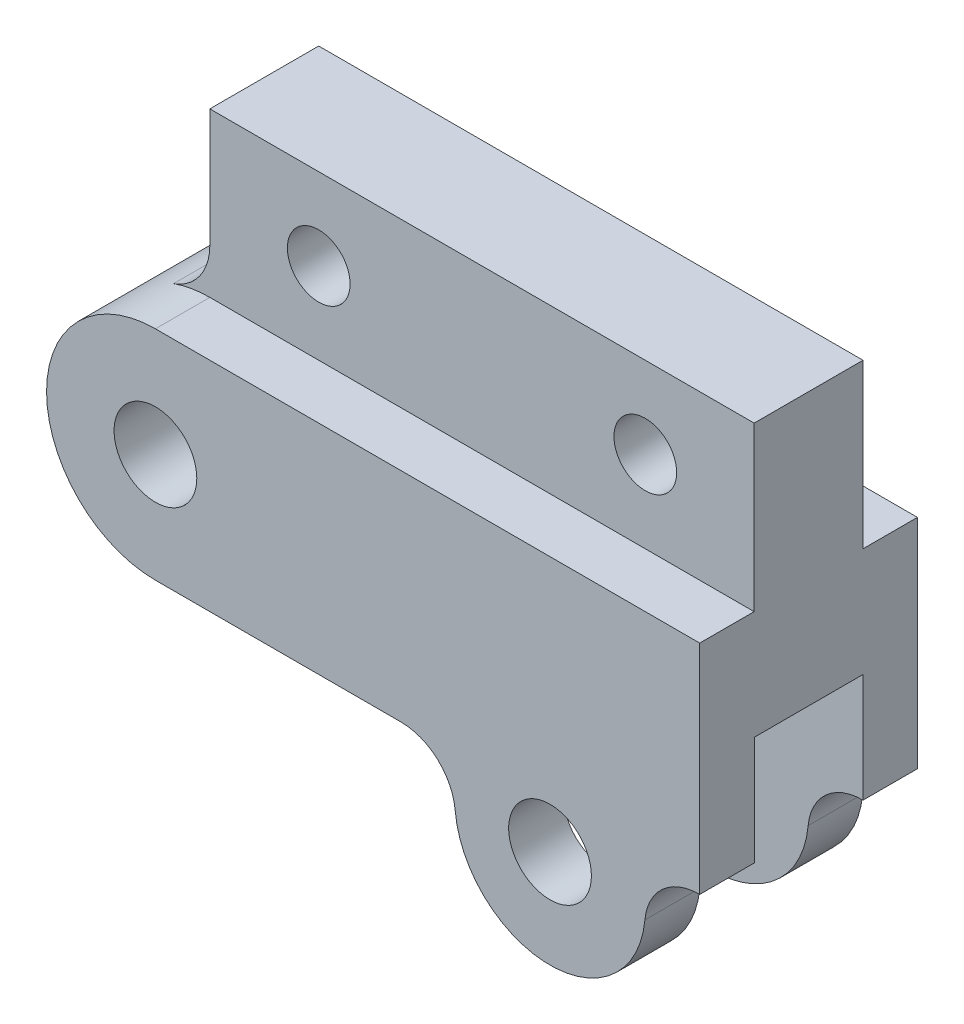
from build123d import *

# Parameters (mm, degrees)
SKETCH1_W                             = 38.1
SKETCH1_H                             = 12.699999999999998
BOSS_EXTRUDE1_DEPTH                   = 6.35
BOSS_EXTRUDE2_DEPTH                   = 3.175
F_6_CLEARANCE_HOLE1_D                 = 3.6576
F_3_16_0_1875_CLEARANCE_DOWEL_HOLE1_D = 4.826
CUT_EXTRUDE3_DEPTH                    = 3.1496
CUT_EXTRUDE3_DEPTH_BACK               = 3.175
SKETCH8_W                             = 17.4625
SKETCH8_H                             = 14.287499999999998
FILLET2_RADIUS                        = 5.55625
FILLET2_LENGTH                        = 3.2004
FILLET3_RADIUS                        = 5.55625
FILLET3_LENGTH                        = 3.175
FILLET5_R                             = 3.175
FILLET7_R                             = 6.35
FILLET8_R                             = 3.175


# Some blends are built 0.0001 mm under size
with BuildPart() as part:
    # Sketch1 → Boss-Extrude1 (new, symmetric)
    with BuildSketch(Plane.XY):
        Polygon((15.875, -14.287499999999998), (15.875, -6.349999999999994), (4.762500000000001, -6.35), (4.762500000000001, -14.287499999999996), align=None)
        Rectangle(SKETCH1_W, SKETCH1_H)
    extrude(amount=BOSS_EXTRUDE1_DEPTH, both=True)

    # Sketch2 → Boss-Extrude2 (add, symmetric)
    with BuildSketch(Plane.XY):
        Polygon((19.05, 6.35), (-12.7, 6.349999999999996), (-12.7, 15.874999999999996), (19.05, 15.875), align=None)
    extrude(amount=BOSS_EXTRUDE2_DEPTH, both=True)

    # #6 Clearance Hole1 (through all)
    with Locations(Plane.XY.offset(3.175)):
        with Locations((-6.35, 11.1125), (12.7, 11.1125)):
            Hole(F_6_CLEARANCE_HOLE1_D / 2)

    # 3/16 (0.1875) Clearance Dowel Hole1 (through all)
    with Locations(Plane.XY.offset(6.35)):
        with Locations((-12.7, 0), (10.31875, -8.5725)):
            Hole(F_3_16_0_1875_CLEARANCE_DOWEL_HOLE1_D / 2)

    # Sketch8 → Cut-Extrude3 (cut, two sides: drawn at the far end of the back side and taken through both)
    with BuildSketch(Plane.XY.offset(-CUT_EXTRUDE3_DEPTH_BACK)):
        with Locations((10.318750000000001, -7.143749999999999)):
            Rectangle(SKETCH8_W, SKETCH8_H)
    extrude(amount=CUT_EXTRUDE3_DEPTH + CUT_EXTRUDE3_DEPTH_BACK, mode=Mode.SUBTRACT)

    # Fillet2: full round fillet: the end face becomes a half cylinder, R = half its width
    fillet2_face = Plane((10.31875, -14.2875, 4.7498), x_dir=(0, 0, 1), z_dir=(0, -1, 0))  # on the end face: x along it, z out of the body
    fillet2_slab = fillet2_face.offset(-FILLET2_RADIUS / 2) * Box(FILLET2_LENGTH, 2 * FILLET2_RADIUS, FILLET2_RADIUS, mode=Mode.PRIVATE)  # the body's end, R deep
    fillet2_round = Plane((10.31875, -8.73125, 4.7498), x_dir=(0, -1, 0), z_dir=(0, 0, 1)) * Cylinder(FILLET2_RADIUS, FILLET2_LENGTH, mode=Mode.PRIVATE)  # its axis R under the face
    add(fillet2_slab - fillet2_round, mode=Mode.SUBTRACT)

    # Fillet3: full round fillet: the end face becomes a half cylinder, R = half its width
    fillet3_face = Plane((10.31875, -14.2875, -4.7625), x_dir=(0, 0, 1), z_dir=(0, -1, 0))  # on the end face: x along it, z out of the body
    fillet3_slab = fillet3_face.offset(-FILLET3_RADIUS / 2) * Box(FILLET3_LENGTH, 2 * FILLET3_RADIUS, FILLET3_RADIUS, mode=Mode.PRIVATE)  # the body's end, R deep
    fillet3_round = Plane((10.31875, -8.73125, -4.7625), x_dir=(0, -1, 0), z_dir=(0, 0, 1)) * Cylinder(FILLET3_RADIUS, FILLET3_LENGTH, mode=Mode.PRIVATE)  # its axis R under the face
    add(fillet3_slab - fillet3_round, mode=Mode.SUBTRACT)

    # Fillet5
    fillet5_edges = [part.edges().sort_by_distance(p)[0] for p in [
        (15.875, -6.349999999999997, 4.7498),
        (15.875, -6.349999999999997, -4.762499999999999),
        (4.762500000000001, -6.349999999999998, -4.762499999999999),
        (4.762500000000001, -6.349999999999998, 4.7498),
    ]]
    fillet(fillet5_edges, radius=FILLET5_R - 0.0001)  # a hair under: the kernel refuses the full size

    # Fillet7
    fillet7_edges = [part.edges().sort_by_distance(p)[0] for p in [
        (-19.05, -6.35, 0),
        (-19.05, 6.35, 0),
    ]]
    fillet(fillet7_edges, radius=FILLET7_R - 0.0001)  # a hair under: the kernel refuses the full size

    # Fillet8
    # the kernel refuses this fillet: 3.175 mm, written as the material it adds along each edge
    with BuildSketch(Plane(origin=(-12.7, 6.349999999999996, 3.175), x_dir=(-0.9856005187452213, -0.16909055990548677, 0), z_dir=(0, 0, -1))) as fillet8_piece_1:
        with BuildLine():
            CenterArc((2.6845252143088953, 3.1292731923549355), FILLET8_R, 189.73494650787575, 70.5292047157078)
            Line((-0.4447564327071806, 2.5924106646550134), (-0.7576845974087891, 2.5387244118850214))
            Line((-0.7576845974087891, 2.5387244118850214), (-0.3129281647016085, -0.05368625276999218))
            Line((-0.3129281647016085, -0.05368625276999218), (0.05368625276999203, -0.31292816470160767))
            ThreePointArc((0.05368625276999203, -0.31292816470160767), (0.05378481282186907, -0.3129112556456122), (2.0939222275177753, -0.31292731923549344))
            Line((2.0939222275177753, -0.31292731923549344), (2.1476134081351503, -2e-17))
        make_face()
    extrude(amount=6.35)


solid = part.part
